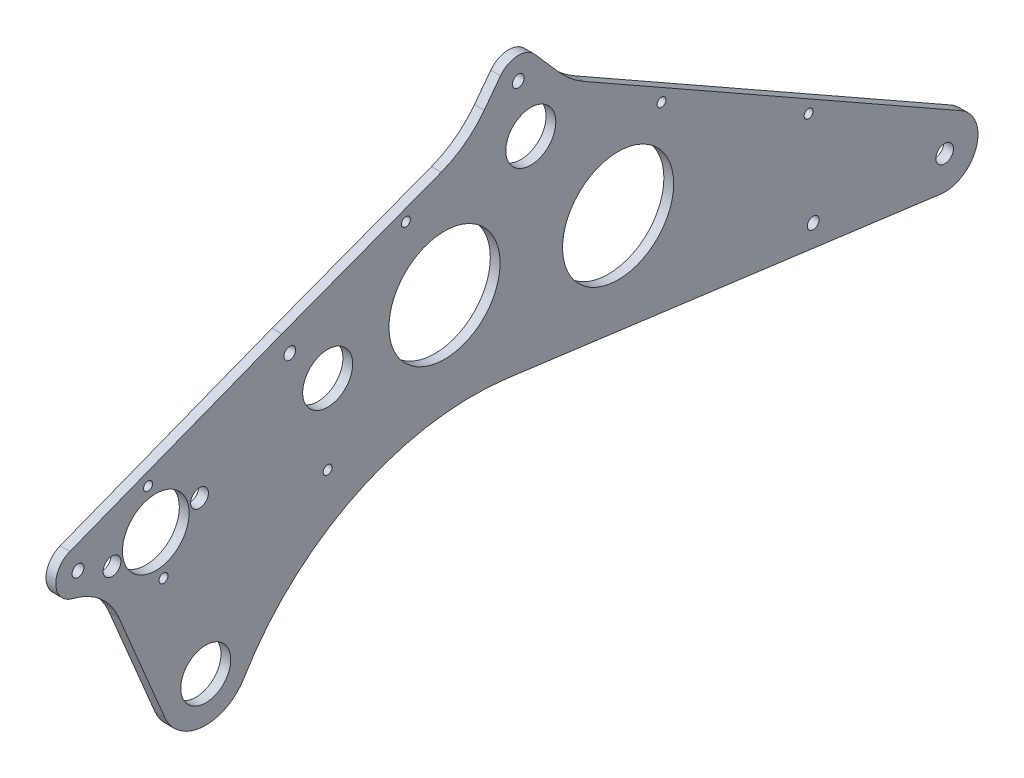
from build123d import *

# Parameters (mm, degrees)
SKETCH2_R           = 14.2875
SKETCH2_R_2         = 19.05
SKETCH2_R_3         = 2.5527
SKETCH2_R_4         = 5.0419
SKETCH2_R_5         = 3.3782
SKETCH2_R_6         = 5.08
BOSS_EXTRUDE1_DEPTH = 5.588
SKETCH4_R           = 31.749999999
SKETCH4_R_2         = 31.75
SKETCH4_R_3         = 2.54
CUT_EXTRUDE1_DEPTH  = 536.87067115


with BuildPart() as part:
    # Sketch2 → Boss-Extrude1 (new body)
    with BuildSketch(Plane(origin=(0, 0, 0), x_dir=(0, 0, -1), z_dir=(1, 0, 0))):
        with BuildLine():
            Line((-445.710958312, -56.214466457), (-472.065797844, 6.601443702))
            ThreePointArc((-472.065797844, 6.601443702), (-482.509199097, 20.878877501), (-498.274718323, 28.901230593))
            ThreePointArc((-498.274718323, 28.901230593), (-507.971250508, 40.393877249), (-499.904646963, 53.083777596))
            Line((-499.904646963, 53.083777596), (-378.873178351, 100.170165216))
            ThreePointArc((-378.873178351, 100.170165216), (-378.816766544, 100.191957311), (-378.760251606, 100.21348054))
            Line((-378.760251606, 100.21348054), (-287.68871214, 134.649237339))
            ThreePointArc((-287.68871214, 134.649237339), (-274.096265675, 142.116919406), (-263.116185035, 153.069485566))
            Line((-263.116185035, 153.069485566), (-253.809934756, 165.419296806))
            ThreePointArc((-253.809934756, 165.419296806), (-244.1402468, 170.46743536), (-234.121630663, 166.153052588))
            Line((-234.121630663, 166.153052588), (-220.225324752, 150.317777333))
            ThreePointArc((-220.225324752, 150.317777333), (-213.579673478, 143.913988769), (-205.960385421, 138.706336869))
            Line((-205.960385421, 138.706336869), (9.397681692, 16.570639059))
            ThreePointArc((9.397681692, 16.570639059), (18.06147284, -6.056872036), (-2.492689106, -18.886211929))
            Line((-2.492689106, -18.886211929), (-249.585398085, 13.726220154))
            ThreePointArc((-249.585398085, 13.726220154), (-335.982789168, -0.216195872), (-400.465765574, -59.384142468))
            ThreePointArc((-400.465765574, -59.384142468), (-424.063968038, -71.725486714), (-445.710958312, -56.214466457))
        make_face()
        with Locations((-236.525067803, 126.839996455)):
            Circle(SKETCH2_R, mode=Mode.SUBTRACT)
        with Locations((-352.615083456, 65.113840211)):
            Circle(SKETCH2_R, mode=Mode.SUBTRACT)
        with Locations((-422.288908015, -46.387587)):
            Circle(SKETCH2_R, mode=Mode.SUBTRACT)
        with Locations((-450.85, 38.1)):
            Circle(SKETCH2_R_2, mode=Mode.SUBTRACT)
        with Locations((-352.615083457, 19.828113514)):
            Circle(SKETCH2_R_3, mode=Mode.SUBTRACT)
        Circle(SKETCH2_R_4, mode=Mode.SUBTRACT)
        with Locations((-75.121943871, 3.279894903)):
            Circle(SKETCH2_R_5, mode=Mode.SUBTRACT)
        with Locations((-374.268531388, 88.334320238)):
            Circle(SKETCH2_R_5, mode=Mode.SUBTRACT)
        with Locations((-243.667263779, 157.776246012)):
            Circle(SKETCH2_R_5, mode=Mode.SUBTRACT)
        with Locations((-425.835883073, 42.510663713)):
            Circle(SKETCH2_R_6, mode=Mode.SUBTRACT)
        with Locations((-455.260663713, 63.114116927)):
            Circle(SKETCH2_R_3, mode=Mode.SUBTRACT)
        with Locations((-475.864116927, 33.689336287)):
            Circle(SKETCH2_R_6, mode=Mode.SUBTRACT)
        with Locations((-446.439336287, 13.085883073)):
            Circle(SKETCH2_R_3, mode=Mode.SUBTRACT)
        with Locations((-495.3, 41.247932618)):
            Circle(SKETCH2_R_5, mode=Mode.SUBTRACT)
    extrude(amount=BOSS_EXTRUDE1_DEPTH)

    # Sketch4 → Cut-Extrude1 (cut, through all)
    with BuildSketch(Plane(origin=(5.588, 0, 0), x_dir=(0, 0, -1), z_dir=(1, 0, 0))):
        with Locations((-285.828920606, 72.85936499)):
            Circle(SKETCH4_R)
        with Locations((-186.635219344, 62.587677704)):
            Circle(SKETCH4_R_2)
        with Locations((-307.895757835, 120.219817132)):
            Circle(SKETCH4_R_3)
        with Locations((-161.782656077, 106.351776712)):
            Circle(SKETCH4_R_3)
        with Locations((-77.758767474, 58.699434709)):
            Circle(SKETCH4_R_3)
    extrude(amount=-CUT_EXTRUDE1_DEPTH, mode=Mode.SUBTRACT)


solid = part.part
